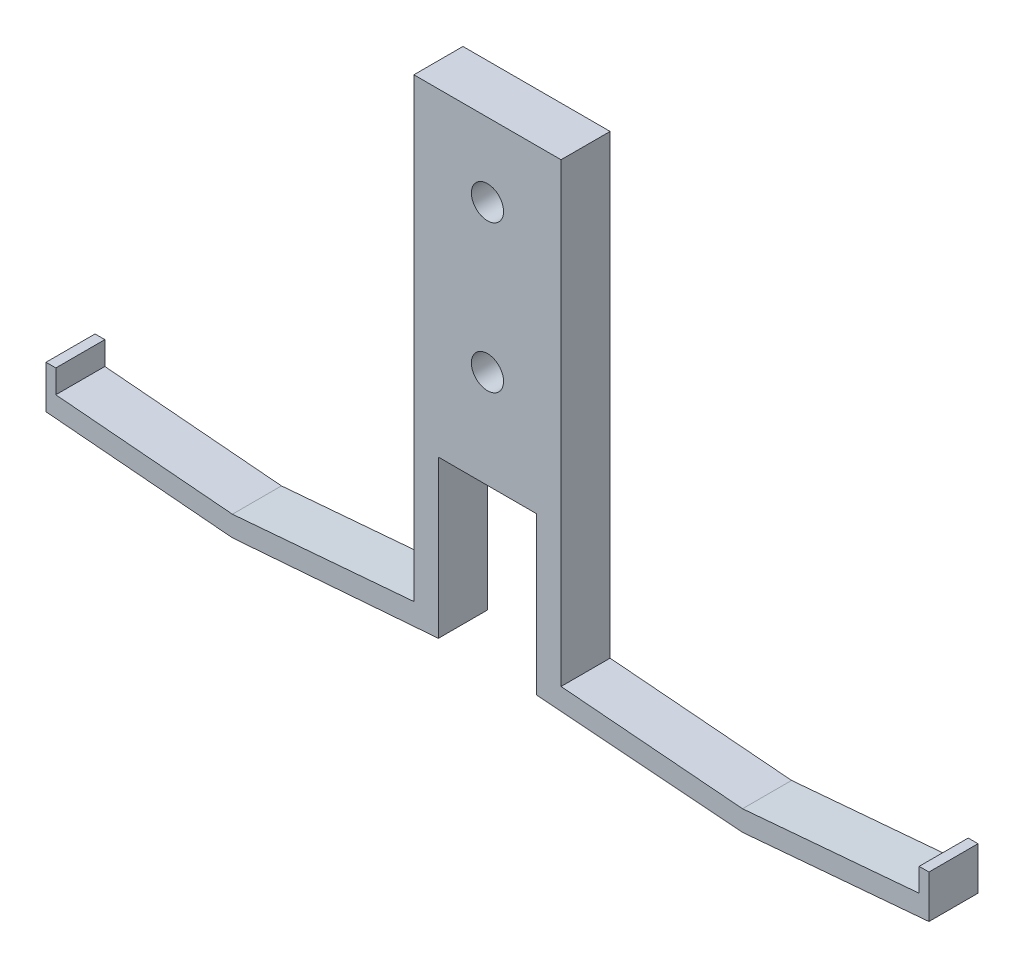
from build123d import *

# Parameters (mm, degrees)
BOSS_EXTRUDE1_DEPTH              = 12.7
F_21_64_0_32813_DIAMETER_HOLE1_D = 8.334502


with BuildPart() as part:
    # Sketch2 → Boss-Extrude1 (new body)
    with BuildSketch(Plane.XY):
        Polygon((12.7, 0), (12.7, -40.64), (66.04, -44.773379719), (114.3, -40.64), (114.3, -29.533379719), (111.76, -29.533379719), (111.76, -35.56), (66.04, -39.475833418), (19.05, -35.56), (19.05, 82.55), (-19.05, 82.55), (-19.05, -35.56), (-66.04, -39.475833418), (-111.76, -35.56), (-111.76, -29.533379719), (-114.3, -29.533379719), (-114.3, -40.64), (-66.04, -44.773379719), (-12.7, -40.64), (-12.7, 0), align=None)
    extrude(amount=BOSS_EXTRUDE1_DEPTH)

    # 21/64 (0.32813) Diameter Hole1 (through all)
    with Locations(Plane.XY.offset(12.7)):
        with Locations((0, 25.4), (0, 63.5)):
            Hole(F_21_64_0_32813_DIAMETER_HOLE1_D / 2)


solid = part.part
